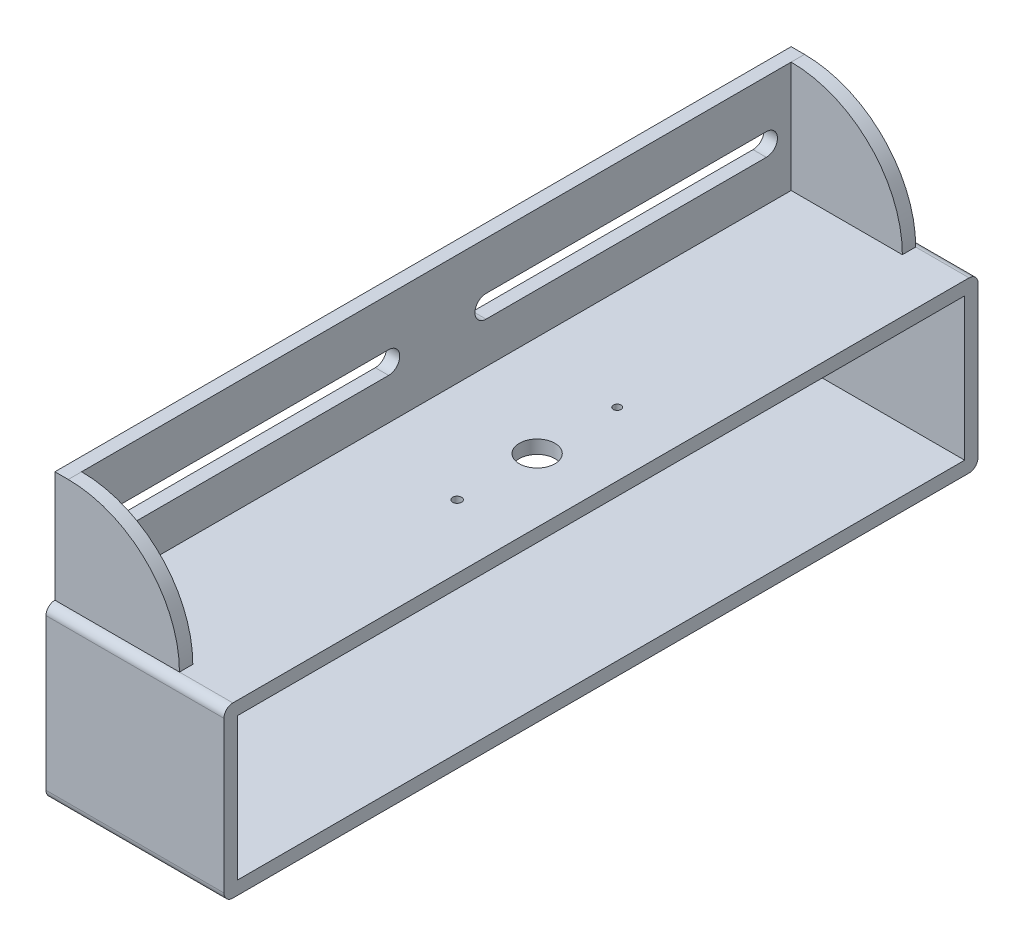
from build123d import *

# Parameters (mm, degrees)
SKETCH1_W            = 169.5
SKETCH1_H            = 38
BOSS_EXTRUDE1_DEPTH  = 3
SKETCH12_W           = 40
SKETCH12_H           = 3
BOSS_EXTRUDE3_DEPTH  = 38
SKETCH16_W           = 37
SKETCH16_H           = 3
BOSS_EXTRUDE4_DEPTH  = 38
SKETCH18_W           = 37
SKETCH18_H           = 163.5
BOSS_EXTRUDE5_DEPTH  = 3
FILLET1_R            = 2
FILLET2_R            = 2
FILLET3_R            = 2
FILLET4_R            = 2
SKETCH37_W           = 165.5
SKETCH37_H           = 25
BOSS_EXTRUDE12_DEPTH = 3
SKETCH40_W           = 25
SKETCH40_H           = 25
BOSS_EXTRUDE13_DEPTH = 3
FILLET11_R           = 25
SKETCH41_W           = 25
SKETCH41_H           = 25
BOSS_EXTRUDE14_DEPTH = 3
FILLET12_R           = 25
CUT_EXTRUDE19_DEPTH  = 10
SKETCH62_R           = 4
CUT_EXTRUDE23_DEPTH  = 10
SKETCH66_R           = 0.875
CUT_EXTRUDE24_DEPTH  = 10
SKETCH63_R           = 1
CUT_EXTRUDE26_DEPTH  = 10
SKETCH19_W           = 37
SKETCH19_H           = 163.5
BOSS_EXTRUDE16_DEPTH = 3
SKETCH123_R          = 13.061371159
CUT_EXTRUDE30_DEPTH  = 3
SKETCH125_R          = 13
CUT_EXTRUDE31_DEPTH  = 3
SKETCH126_R          = 13
CUT_EXTRUDE32_DEPTH  = 3
SKETCH67_R           = 12
CUT_EXTRUDE33_DEPTH  = 3
SKETCH118_R          = 12
CUT_EXTRUDE34_DEPTH  = 3


with BuildPart() as part:
    # Sketch1 → Boss-Extrude1 (new body)
    with BuildSketch(Plane(origin=(0, 0, 0), x_dir=(0, 0, -1), z_dir=(1, 0, 0))):
        with Locations((84.75, 19)):
            Rectangle(SKETCH1_W, SKETCH1_H)
    extrude(amount=BOSS_EXTRUDE1_DEPTH)

    # Sketch12 → Boss-Extrude3 (add)
    with BuildSketch(Plane(origin=(0, 0, -169.5), x_dir=(1, 0, 0), z_dir=(0, 1, 0))):
        with Locations((20, -1.5)):
            Rectangle(SKETCH12_W, SKETCH12_H)
    extrude(amount=BOSS_EXTRUDE3_DEPTH)

    # Sketch16 → Boss-Extrude4 (add)
    with BuildSketch(Plane(origin=(3, 0, 0), x_dir=(1, 0, 0), z_dir=(0, 1, 0))):
        with Locations((18.5, 1.5)):
            Rectangle(SKETCH16_W, SKETCH16_H)
    extrude(amount=BOSS_EXTRUDE4_DEPTH)

    # Sketch18 → Boss-Extrude5 (add)
    with BuildSketch(Plane(origin=(0, 38, 0), x_dir=(1, 0, 0), z_dir=(0, 1, 0))):
        with Locations((21.5, 84.75)):
            Rectangle(SKETCH18_W, SKETCH18_H)
    extrude(amount=-BOSS_EXTRUDE5_DEPTH)

    # Fillet1
    fillet1_edges = [part.edges().sort_by_distance(p)[0] for p in [
        (20, 0, 0),
    ]]
    fillet(fillet1_edges, radius=FILLET1_R)

    # Fillet2
    fillet2_edges = [part.edges().sort_by_distance(p)[0] for p in [
        (20, 38, 0),
    ]]
    fillet(fillet2_edges, radius=FILLET2_R)

    # Fillet3
    fillet3_edges = [part.edges().sort_by_distance(p)[0] for p in [
        (20, 38, -169.5),
    ]]
    fillet(fillet3_edges, radius=FILLET3_R)

    # Fillet4
    fillet4_edges = [part.edges().sort_by_distance(p)[0] for p in [
        (20, 0, -169.5),
    ]]
    fillet(fillet4_edges, radius=FILLET4_R)

    # Sketch37 → Boss-Extrude12 (add)
    with BuildSketch(Plane.ZY):
        with Locations((-84.75, 50.5)):
            Rectangle(SKETCH37_W, SKETCH37_H)
    extrude(amount=-BOSS_EXTRUDE12_DEPTH)

    # Sketch40 → Boss-Extrude13 (add)
    with BuildSketch(Plane(origin=(0, 0, -167.5), x_dir=(-1, 0, 0), z_dir=(0, 0, -1))):
        with Locations((-15.5, 50.5)):
            Rectangle(SKETCH40_W, SKETCH40_H)
    extrude(amount=-BOSS_EXTRUDE13_DEPTH)

    # Fillet11
    fillet11_edges = [part.edges().sort_by_distance(p)[0] for p in [
        (28, 63, -166),
    ]]
    fillet(fillet11_edges, radius=FILLET11_R - 0.0001)  # a hair under: the kernel refuses the full size

    # Sketch41 → Boss-Extrude14 (add)
    with BuildSketch(Plane.XY.offset(-2)):
        with Locations((15.5, 50.5)):
            Rectangle(SKETCH41_W, SKETCH41_H)
    extrude(amount=-BOSS_EXTRUDE14_DEPTH)

    # Fillet12
    fillet12_edges = [part.edges().sort_by_distance(p)[0] for p in [
        (28, 63, -3.5),
    ]]
    fillet(fillet12_edges, radius=FILLET12_R - 0.0001)  # a hair under: the kernel refuses the full size

    # Sketch57 → Cut-Extrude19 (cut)
    with BuildSketch(Plane(origin=(3, 0, 0), x_dir=(0, 0, -1), z_dir=(1, 0, 0))):
        with BuildLine():
            Line((11.018645082, 52.249341523), (74.018645082, 52.249341523))
            ThreePointArc((74.018645082, 52.249341523), (76.518645082, 49.749341523), (74.018645082, 47.249341523))
            Line((74.018645082, 47.249341523), (11.018645082, 47.249341523))
            ThreePointArc((11.018645082, 47.249341523), (8.518645082, 49.749341523), (11.018645082, 52.249341523))
        make_face()
        with BuildLine():
            Line((158.918944647, 47.24934152), (95.918944647, 47.24934152))
            ThreePointArc((95.918944647, 47.24934152), (93.418944647, 49.74934152), (95.918944647, 52.24934152))
            Line((95.918944647, 52.24934152), (158.918944647, 52.24934152))
            ThreePointArc((158.918944647, 52.24934152), (161.418944647, 49.74934152), (158.918944647, 47.24934152))
        make_face()
    extrude(amount=-CUT_EXTRUDE19_DEPTH, mode=Mode.SUBTRACT)

    # Sketch62 → Cut-Extrude23 (cut)
    with BuildSketch(Plane(origin=(0, 38, 0), x_dir=(1, 0, 0), z_dir=(0, 1, 0))):
        with Locations(Location((25.649526178, 84.75, 0), (0, 0, 270))):
            Circle(SKETCH62_R)
    extrude(amount=-CUT_EXTRUDE23_DEPTH, mode=Mode.SUBTRACT)

    # Sketch66 → Cut-Extrude24 (cut)
    with BuildSketch(Plane(origin=(0, 38, 0), x_dir=(1, 0, 0), z_dir=(0, 1, 0))):
        with Locations(Location((25.649526178, 102.75, 0), (0, 0, 270))):
            Circle(SKETCH66_R)
    extrude(amount=-CUT_EXTRUDE24_DEPTH, mode=Mode.SUBTRACT)

    # Sketch63 → Cut-Extrude26 (cut)
    with BuildSketch(Plane(origin=(0, 38, 0), x_dir=(1, 0, 0), z_dir=(0, 1, 0))):
        with Locations(Location((25.649526178, 66.75, 0), (0, 0, 270))):
            Circle(SKETCH63_R)
    extrude(amount=-CUT_EXTRUDE26_DEPTH, mode=Mode.SUBTRACT)

    # Sketch19 → Boss-Extrude16 (add)
    with BuildSketch(Plane(origin=(0, 0, 0), x_dir=(-1, 0, 0), z_dir=(0, -1, 0))):
        with Locations((-21.5, 84.75)):
            Rectangle(SKETCH19_W, SKETCH19_H)
    extrude(amount=-BOSS_EXTRUDE16_DEPTH)

    # Sketch123 → Cut-Extrude30 (cut)
    with BuildSketch(Plane.ZY):
        with Locations((-144.75, 20.2809694)):
            Circle(SKETCH123_R)
    extrude(amount=-CUT_EXTRUDE30_DEPTH, mode=Mode.SUBTRACT)

    # Sketch125 → Cut-Extrude31 (cut)
    with BuildSketch(Plane.ZY):
        with Locations((-24.75, 20.2809694)):
            Circle(SKETCH125_R)
    extrude(amount=-CUT_EXTRUDE31_DEPTH, mode=Mode.SUBTRACT)

    # Sketch126 → Cut-Extrude32 (cut)
    with BuildSketch(Plane.ZY):
        with Locations((-114.75, 20.2809694)):
            Circle(SKETCH126_R)
    extrude(amount=-CUT_EXTRUDE32_DEPTH, mode=Mode.SUBTRACT)

    # Sketch67 → Cut-Extrude33 (cut)
    with BuildSketch(Plane.ZY):
        with Locations((-84.75, 20.2809694)):
            Circle(SKETCH67_R)
    extrude(amount=-CUT_EXTRUDE33_DEPTH, mode=Mode.SUBTRACT)

    # Sketch118 → Cut-Extrude34 (cut)
    with BuildSketch(Plane.ZY):
        with Locations((-54.75, 20.2809694)):
            Circle(SKETCH118_R)
    extrude(amount=-CUT_EXTRUDE34_DEPTH, mode=Mode.SUBTRACT)


solid = part.part
